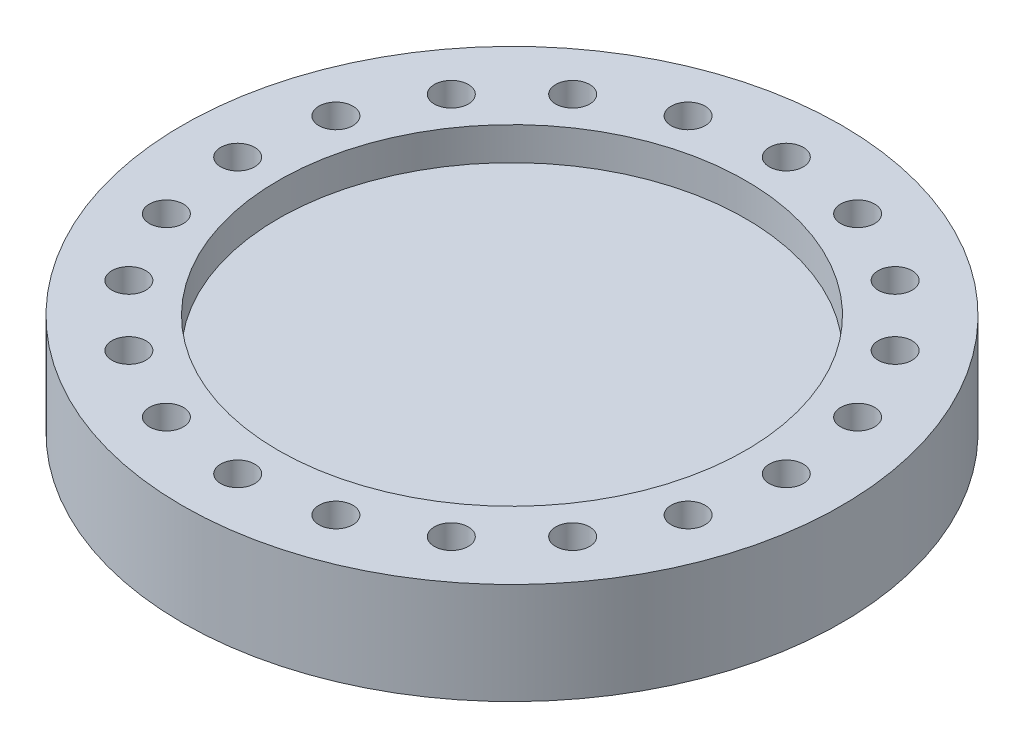
from build123d import *

# Parameters (mm, degrees)
SKETCH1_R           = 32.5
SKETCH1_R_2         = 1.675
BOSS_EXTRUDE1_DEPTH = 10
SKETCH2_R           = 23.05
CUT_EXTRUDE1_DEPTH  = 3.25


with BuildPart() as part:
    # Sketch1 → Boss-Extrude1 (new body)
    with BuildSketch(Plane(origin=(0, 0, 0), x_dir=(1, 0, 0), z_dir=(0, 1, 0))):
        Circle(SKETCH1_R)
        with Locations((15.899591075, 21.883909698)):
            Circle(SKETCH1_R_2, mode=Mode.SUBTRACT)
        with Locations((21.883909698, 15.899591075)):
            Circle(SKETCH1_R_2, mode=Mode.SUBTRACT)
        with Locations((25.726078766, 8.358909698)):
            Circle(SKETCH1_R_2, mode=Mode.SUBTRACT)
        with Locations((27.05, 0)):
            Circle(SKETCH1_R_2, mode=Mode.SUBTRACT)
        with Locations((25.726078766, -8.358909698)):
            Circle(SKETCH1_R_2, mode=Mode.SUBTRACT)
        with Locations((21.883909698, -15.899591075)):
            Circle(SKETCH1_R_2, mode=Mode.SUBTRACT)
        with Locations((15.899591075, -21.883909698)):
            Circle(SKETCH1_R_2, mode=Mode.SUBTRACT)
        with Locations((8.358909698, -25.726078766)):
            Circle(SKETCH1_R_2, mode=Mode.SUBTRACT)
        with Locations((0, -27.05)):
            Circle(SKETCH1_R_2, mode=Mode.SUBTRACT)
        with Locations((-8.358909698, -25.726078766)):
            Circle(SKETCH1_R_2, mode=Mode.SUBTRACT)
        with Locations((-15.899591075, -21.883909698)):
            Circle(SKETCH1_R_2, mode=Mode.SUBTRACT)
        with Locations((-21.883909698, -15.899591075)):
            Circle(SKETCH1_R_2, mode=Mode.SUBTRACT)
        with Locations((-25.726078766, -8.358909698)):
            Circle(SKETCH1_R_2, mode=Mode.SUBTRACT)
        with Locations((-27.05, 0)):
            Circle(SKETCH1_R_2, mode=Mode.SUBTRACT)
        with Locations((-25.726078766, 8.358909698)):
            Circle(SKETCH1_R_2, mode=Mode.SUBTRACT)
        with Locations((-21.883909698, 15.899591075)):
            Circle(SKETCH1_R_2, mode=Mode.SUBTRACT)
        with Locations((-15.899591075, 21.883909698)):
            Circle(SKETCH1_R_2, mode=Mode.SUBTRACT)
        with Locations((-8.358909698, 25.726078766)):
            Circle(SKETCH1_R_2, mode=Mode.SUBTRACT)
        with Locations((0, 27.05)):
            Circle(SKETCH1_R_2, mode=Mode.SUBTRACT)
        with Locations((8.358909698, 25.726078766)):
            Circle(SKETCH1_R_2, mode=Mode.SUBTRACT)
    extrude(amount=BOSS_EXTRUDE1_DEPTH)

    # Sketch2 → Cut-Extrude1 (cut)
    with BuildSketch(Plane(origin=(0, 10, 0), x_dir=(1, 0, 0), z_dir=(0, 1, 0))):
        Circle(SKETCH2_R)
    extrude(amount=-CUT_EXTRUDE1_DEPTH, mode=Mode.SUBTRACT)


solid = part.part
